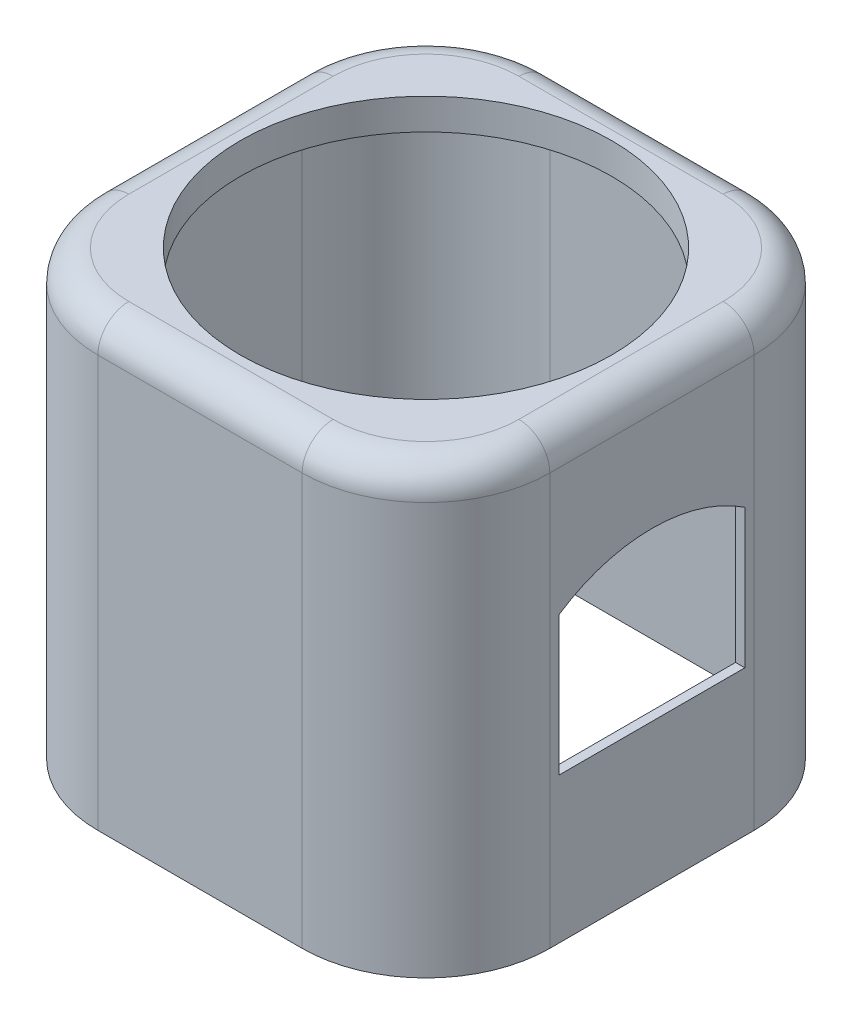
from build123d import *

# Parameters (mm, degrees)
SKETCH5_W           = 146
SKETCH5_H           = 146
BOSS_EXTRUDE2_DEPTH = 250
FILLET8_R           = 40
FILLET9_R           = 40
FILLET10_R          = 40
FILLET11_R          = 40
FILLET12_R          = 10
BOSS_EXTRUDE5_START = -240
BOSS_EXTRUDE5_DEPTH = 240
SKETCH8_R           = 60
CUT_EXTRUDE1_DEPTH  = 34
SKETCH10_W          = 44
SKETCH10_H          = 33
CUT_EXTRUDE2_DEPTH  = 3
CUT_EXTRUDE3_DEPTH  = 3
SKETCH12_W          = 157.188162186
SKETCH12_H          = 158.114359626
CUT_EXTRUDE4_DEPTH  = 107
SKETCH15_W          = 32
SKETCH15_H          = 13
CUT_EXTRUDE7_DEPTH  = 5
CUT_EXTRUDE9_DEPTH  = 5


# Read off the part's stored shape, not the designer's step: Boss-Extrude5
with BuildPart() as part:
    # Sketch5 → Boss-Extrude2 (new body)
    with BuildSketch(Plane(origin=(0, 0, 0), x_dir=(1, 0, 0), z_dir=(0, 1, 0))):
        Rectangle(SKETCH5_W, SKETCH5_H)
    extrude(amount=BOSS_EXTRUDE2_DEPTH)

    # Fillet8
    fillet8_edges = [part.edges().sort_by_distance(p)[0] for p in [
        (73, 125, 73),
    ]]
    fillet(fillet8_edges, radius=FILLET8_R)

    # Fillet9
    fillet9_edges = [part.edges().sort_by_distance(p)[0] for p in [
        (73, 125, -73),
    ]]
    fillet(fillet9_edges, radius=FILLET9_R)

    # Fillet10
    fillet10_edges = [part.edges().sort_by_distance(p)[0] for p in [
        (-73, 125, -73),
    ]]
    fillet(fillet10_edges, radius=FILLET10_R)

    # Fillet11
    fillet11_edges = [part.edges().sort_by_distance(p)[0] for p in [
        (-73, 125, 73),
    ]]
    fillet(fillet11_edges, radius=FILLET11_R)

    # Fillet12
    fillet12_edges = [part.edges().sort_by_distance(p)[0] for p in [
        (73, 250, 0),
        (61.284271247, 250, 61.284271247),
        (0, 250, -73),
        (61.284271247, 250, -61.284271247),
        (-73, 250, 0),
        (-61.284271247, 250, -61.284271247),
        (0, 250, 73),
        (-61.284271247, 250, 61.284271247),
    ]]
    fillet(fillet12_edges, radius=FILLET12_R)

    # Boss-Extrude5 outline → Boss-Extrude5 (cut)
    with BuildSketch(Plane.XZ.offset(BOSS_EXTRUDE5_START)):
        with BuildLine():
            Line((30, 70), (-30, 70))
            ThreePointArc((-30, 70), (-58.284271247, 58.284271247), (-70, 30))
            Line((-70, 30), (-70, -30))
            ThreePointArc((-70, -30), (-58.284271247, -58.284271247), (-30, -70))
            Line((-30, -70), (30, -70))
            ThreePointArc((30, -70), (58.284271247, -58.284271247), (70, -30))
            Line((70, -30), (70, 30))
            ThreePointArc((70, 30), (58.284271247, 58.284271247), (30, 70))
        make_face()
    extrude(amount=BOSS_EXTRUDE5_DEPTH, mode=Mode.SUBTRACT)

    # Sketch8 → Cut-Extrude1 (cut)
    with BuildSketch(Plane(origin=(0, 250, 0), x_dir=(1, 0, 0), z_dir=(0, 1, 0))):
        with Locations(Location((0, 0, 0), (0, 0, 270))):
            Circle(SKETCH8_R)
    extrude(amount=-CUT_EXTRUDE1_DEPTH, mode=Mode.SUBTRACT)

    # Sketch10 → Cut-Extrude2 (cut)
    with BuildSketch(Plane(origin=(73, 0, 0), x_dir=(0, 0, -1), z_dir=(1, 0, 0))):
        with Locations((0, 63.5)):
            Rectangle(SKETCH10_W, SKETCH10_H)
    extrude(amount=-CUT_EXTRUDE2_DEPTH, mode=Mode.SUBTRACT)

    # Sketch11 → Cut-Extrude3 (cut)
    with BuildSketch(Plane.ZY.offset(73)):
        Polygon((0, 0), (-16, 0), (-16, 13), (16, 13), (16, 0), align=None)
    extrude(amount=-CUT_EXTRUDE3_DEPTH, mode=Mode.SUBTRACT)

    # Sketch12 → Cut-Extrude4 (cut)
    with BuildSketch(Plane.XZ):
        with Locations((-1.675039252, -2.437620076)):
            Rectangle(SKETCH12_W, SKETCH12_H)
    extrude(amount=-CUT_EXTRUDE4_DEPTH, mode=Mode.SUBTRACT)

    # Sketch15 → Cut-Extrude7 (cut)
    with BuildSketch(Plane.ZY.offset(73)):
        with Locations((0, 113.5)):
            Rectangle(SKETCH15_W, SKETCH15_H)
    extrude(amount=-CUT_EXTRUDE7_DEPTH, mode=Mode.SUBTRACT)

    # Sketch17 → Cut-Extrude9 (cut)
    with BuildSketch(Plane.ZY.offset(-70)):
        with BuildLine():
            Line((30, 154), (-30, 154))
            Line((-30, 154), (-30, 198.899888641))
            ThreePointArc((-30, 198.899888641), (0, 208), (30, 198.899888641))
            Line((30, 198.899888641), (30, 154))
        make_face()
    extrude(amount=-CUT_EXTRUDE9_DEPTH, mode=Mode.SUBTRACT)


solid = part.part
